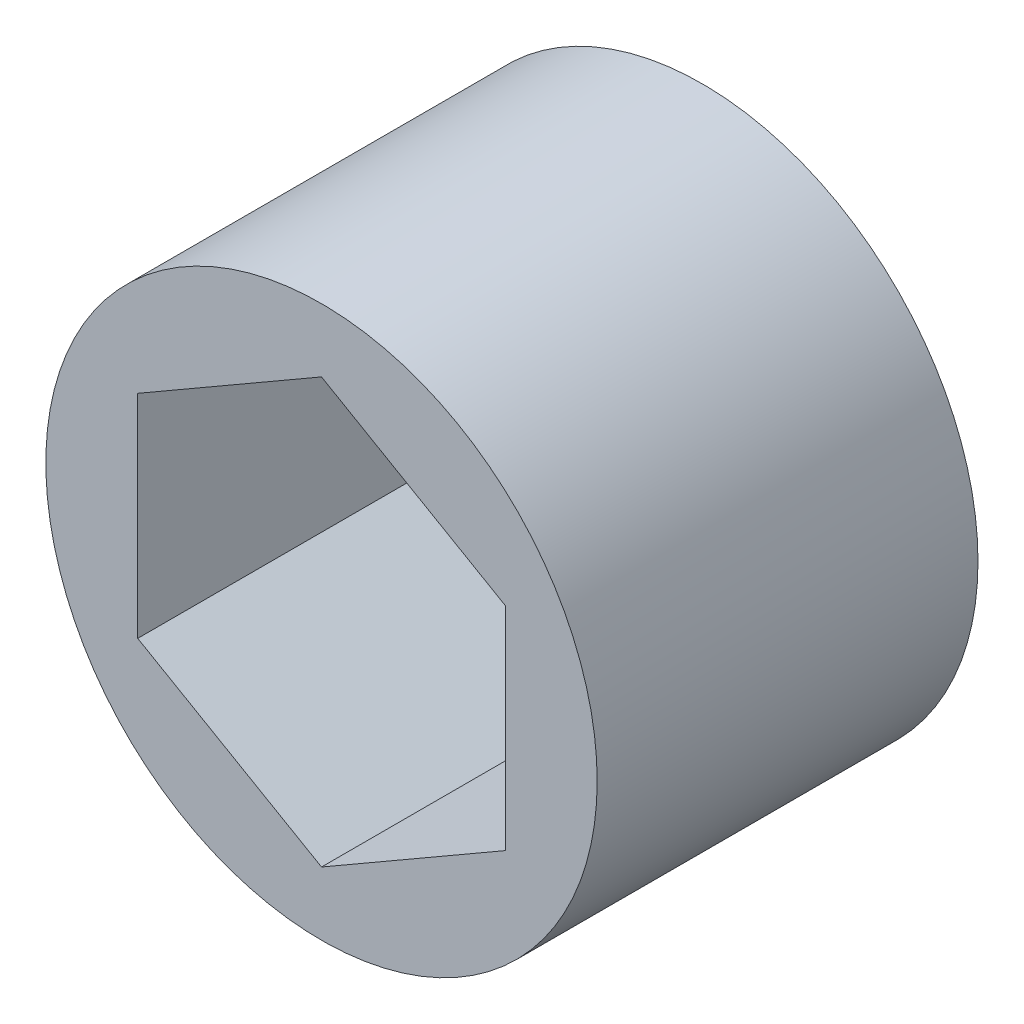
from build123d import *

# Parameters (mm, degrees)
SKETCH2_R           = 9.525
BOSS_EXTRUDE1_DEPTH = 13.1572


with BuildPart() as part:
    # Sketch2 → Boss-Extrude1 (new body)
    with BuildSketch(Plane.XY):
        Circle(SKETCH2_R)
        Polygon((0, 7.332348419), (-6.35, 3.666174209), (-6.35, -3.666174209), (0, -7.332348419), (6.35, -3.666174209), (6.35, 3.666174209), align=None, mode=Mode.SUBTRACT)
    extrude(amount=BOSS_EXTRUDE1_DEPTH)


solid = part.part
